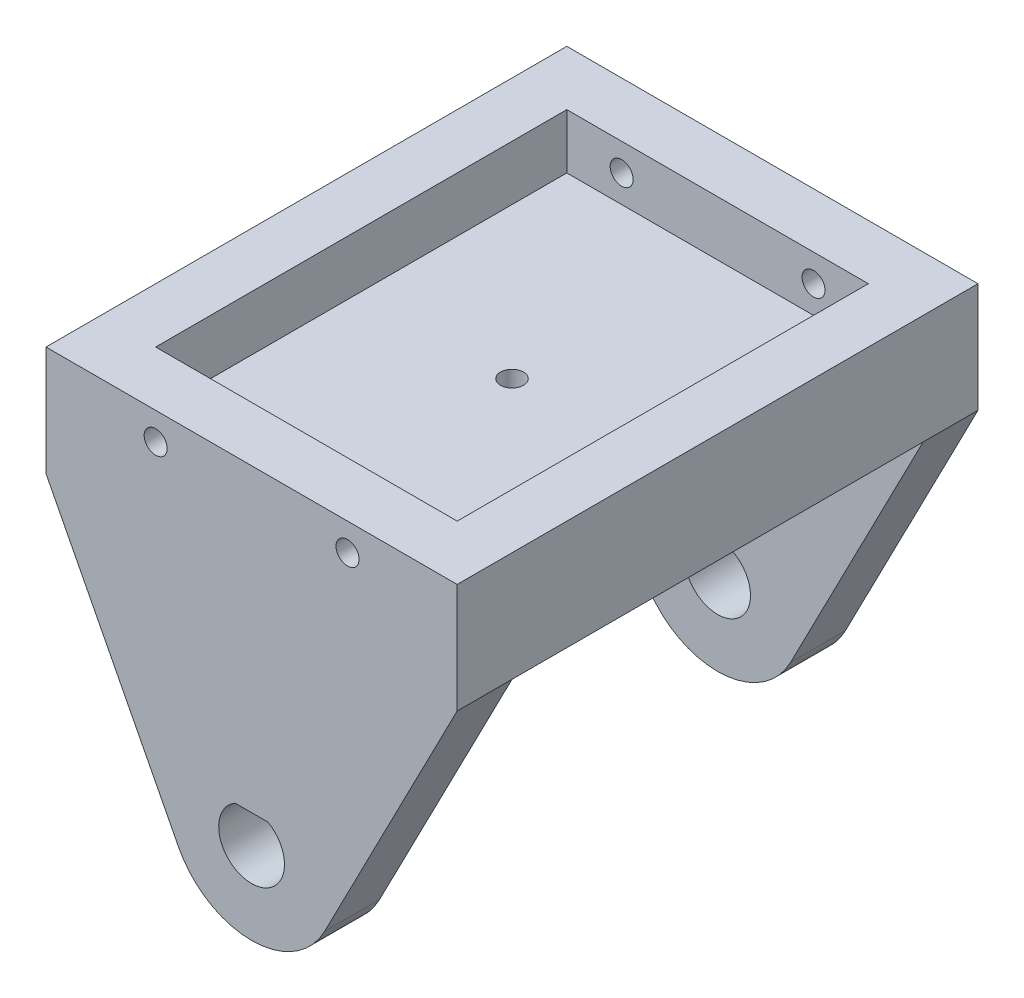
from build123d import *

# Parameters (mm, degrees)
BOSS_EXTRUDE1_DEPTH             = 10
SKETCH1_3_W                     = 75
SKETCH1_3_H                     = 20
BOSS_EXTRUDE2_DEPTH             = 95
SKETCH8_W                       = 55
SKETCH8_H                       = 75
CUT_EXTRUDE2_DEPTH              = 10
TAP_DRILL_FOR_M5X0_8_TAP2_D     = 4.2
TAP_DRILL_FOR_M5X0_8_TAP3_D     = 4.2
TAP_DRILL_FOR_M5X0_8_TAP3_DEPTH = 10
TAP_DRILL_FOR_M5X0_8_TAP3_TIP   = 1.2618073


with BuildPart() as part:
    # Sketch1 → Boss-Extrude1 (new body)
    with BuildSketch(Plane.XY):
        with BuildLine():
            ThreePointArc((-13.332236063, -6.873971309), (0, -15), (13.332236063, -6.873971309))
            Line((13.332236063, -6.873971309), (37.5, 40))
            Line((37.5, 40), (-37.5, 40))
            Line((-37.5, 40), (-13.332236063, -6.873971309))
        make_face()
        with BuildLine():
            Line((-3, 5.196152423), (3, 5.196152423))
            ThreePointArc((3, 5.196152423), (0, -6), (-3, 5.196152423))
        make_face(mode=Mode.SUBTRACT)
    boss_extrude1 = extrude(amount=-BOSS_EXTRUDE1_DEPTH)

    # Sketch1<3> → Boss-Extrude2 (add)
    with BuildSketch(Plane.XY):
        with Locations((0, 50)):
            Rectangle(SKETCH1_3_W, SKETCH1_3_H)
    extrude(amount=-BOSS_EXTRUDE2_DEPTH)

    # Mirror2: Boss-Extrude1 across plane
    add(boss_extrude1.mirror(Plane.XY.offset(-47.5)))

    # Sketch8 → Cut-Extrude2 (cut)
    with BuildSketch(Plane(origin=(0, 60, 0), x_dir=(1, 0, 0), z_dir=(0, 1, 0))):
        with Locations((0, 47.5)):
            Rectangle(SKETCH8_W, SKETCH8_H)
    extrude(amount=-CUT_EXTRUDE2_DEPTH, mode=Mode.SUBTRACT)

    # Tap Drill for M5x0.8 Tap2 (through all)
    with Locations(Plane.XY):
        with Locations((-17.5, 55), (17.5, 55)):
            Hole(TAP_DRILL_FOR_M5X0_8_TAP2_D / 2)

    # Tap Drill for M5x0.8 Tap3
    with Locations(Plane(origin=(0, 50, 0), x_dir=(1, 0, 0), z_dir=(0, 1, 0))):
        with Locations((0, 47.5)):
            Hole(TAP_DRILL_FOR_M5X0_8_TAP3_D / 2, depth=TAP_DRILL_FOR_M5X0_8_TAP3_DEPTH)
            with Locations((0, 0, -(TAP_DRILL_FOR_M5X0_8_TAP3_DEPTH + TAP_DRILL_FOR_M5X0_8_TAP3_TIP / 2))):  # 118° drill point
                Cone(0, TAP_DRILL_FOR_M5X0_8_TAP3_D / 2, TAP_DRILL_FOR_M5X0_8_TAP3_TIP, mode=Mode.SUBTRACT)


solid = part.part
